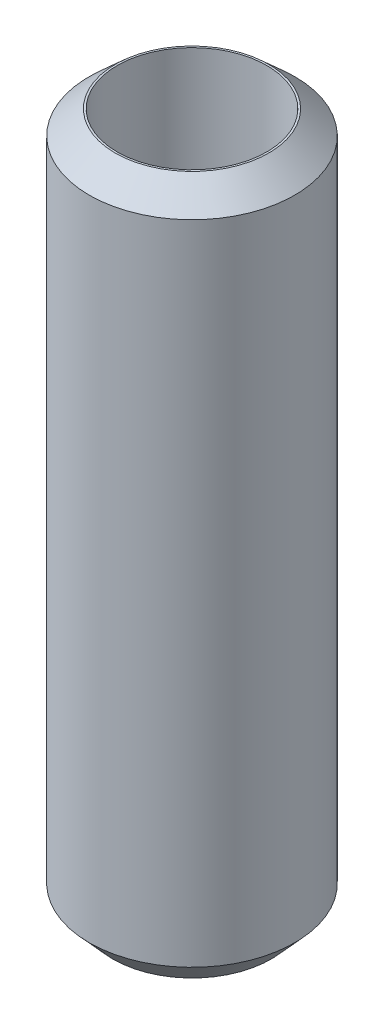
from build123d import *
from OCP.BRepFilletAPI import BRepFilletAPI_MakeChamfer

# Parameters (mm, degrees)
SKETCH1_R           = 25
BOSS_EXTRUDE1_DEPTH = 169.547093007
SKETCH2_R           = 18.217236698
CUT_EXTRUDE1_DEPTH  = 174.194159102
CHAMFER1_SIZE       = 5.72216032
CHAMFER1_SIZE2      = 6.310151891


with BuildPart() as part:
    # Sketch1 → Boss-Extrude1 (new body)
    with BuildSketch(Plane(origin=(0, 0, 0), x_dir=(1, 0, 0), z_dir=(0, 1, 0))):
        Circle(SKETCH1_R)
    extrude(amount=BOSS_EXTRUDE1_DEPTH)

    # Sketch2 → Cut-Extrude1 (cut, through all)
    with BuildSketch(Plane(origin=(0, 0, 0), x_dir=(1, 0, 0), z_dir=(0, 1, 0))):
        Circle(SKETCH2_R)
    extrude(amount=CUT_EXTRUDE1_DEPTH, mode=Mode.SUBTRACT)

    # Chamfer1: one chamfer whose edges measure the first distance from different faces: ONE call of the kernel's chamfer builder (chamfer() names one face for all edges)
    chamfer1_edges_1 = [part.edges().sort_by_distance(p)[0] for p in [
        (-25, 169.547093007, 0),
    ]]
    chamfer1_side_1 = [part.faces().sort_by_distance(p)[0] for p in [
        (-25, 84.773546504, 0),
    ]]
    chamfer1_edges_2 = [part.edges().sort_by_distance(p)[0] for p in [
        (-25, 0, 0),
    ]]
    chamfer1_side_2 = [part.faces().sort_by_distance(p)[0] for p in [
        (-24.292893219, 0, 0),
    ]]
    chamfer1 = BRepFilletAPI_MakeChamfer(part.part.solid().wrapped)
    for e in chamfer1_edges_1:
        chamfer1.Add(CHAMFER1_SIZE, CHAMFER1_SIZE2, e.wrapped, chamfer1_side_1[0].wrapped)  # the first distance lies on this face
    for e in chamfer1_edges_2:
        chamfer1.Add(CHAMFER1_SIZE, CHAMFER1_SIZE2, e.wrapped, chamfer1_side_2[0].wrapped)  # the first distance lies on this face
    add(Compound.cast(chamfer1.Shape()), mode=Mode.REPLACE)


solid = part.part
